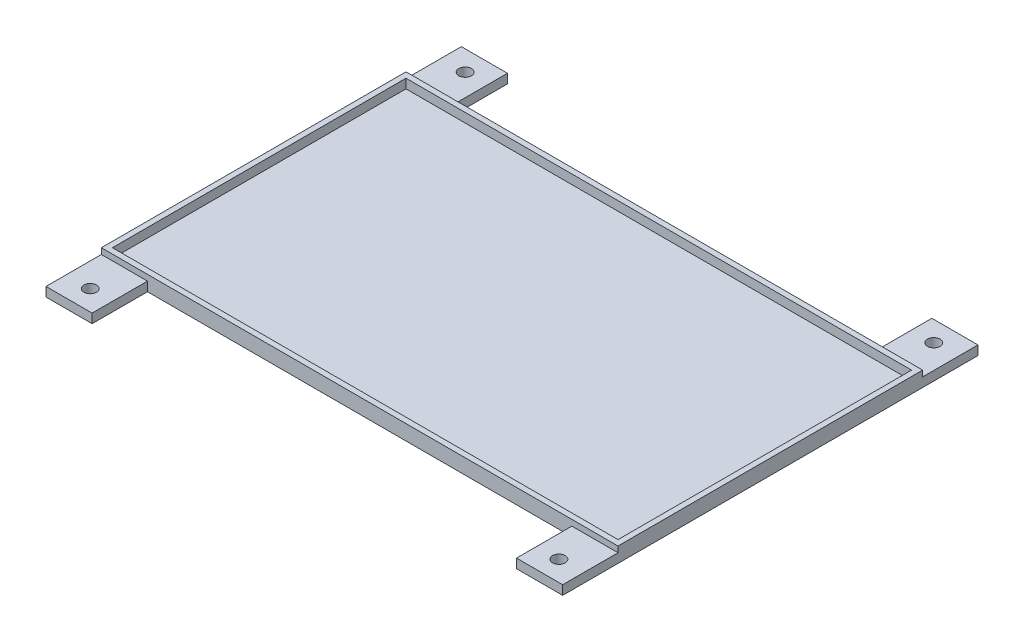
from build123d import *

# Parameters (mm, degrees)
SKETCH1_W           = 280
SKETCH1_H           = 165.1
BOSS_EXTRUDE1_DEPTH = 3.175
SKETCH2_W           = 280
SKETCH2_H           = 165.1
SKETCH2_W_2         = 274
SKETCH2_H_2         = 159.1
BOSS_EXTRUDE2_DEPTH = 5
SKETCH3_W           = 25
SKETCH3_H           = 30
SKETCH3_R           = 3.429
BOSS_EXTRUDE3_DEPTH = 5


with BuildPart() as part:
    # Sketch1 → Boss-Extrude1 (new body)
    with BuildSketch(Plane(origin=(0, 0, 0), x_dir=(1, 0, 0), z_dir=(0, 1, 0))):
        Rectangle(SKETCH1_W, SKETCH1_H)
    extrude(amount=BOSS_EXTRUDE1_DEPTH)

    # Sketch2 → Boss-Extrude2 (add)
    with BuildSketch(Plane(origin=(0, 3.175, 0), x_dir=(1, 0, 0), z_dir=(0, 1, 0))):
        Rectangle(SKETCH2_W, SKETCH2_H)
        Rectangle(SKETCH2_W_2, SKETCH2_H_2, mode=Mode.SUBTRACT)
    extrude(amount=BOSS_EXTRUDE2_DEPTH)

    # Sketch3 → Boss-Extrude3 (add)
    # profile 1 of 4: a face of its own
    with BuildSketch(Plane(origin=(0, 0, 0), x_dir=(1, 0, 0), z_dir=(0, 1, 0))):
        with Locations((-127.5, 97.55)):
            Rectangle(SKETCH3_W, SKETCH3_H)
        with Locations((-127, 101.6)):
            Circle(SKETCH3_R, mode=Mode.SUBTRACT)
    # profile 2 of 4: a face of its own
    with BuildSketch(Plane(origin=(0, 0, 0), x_dir=(1, 0, 0), z_dir=(0, 1, 0))):
        with Locations((127.5, 97.55)):
            Rectangle(SKETCH3_W, SKETCH3_H)
        with Locations((127, 101.6)):
            Circle(SKETCH3_R, mode=Mode.SUBTRACT)
    # profile 3 of 4: a face of its own
    with BuildSketch(Plane(origin=(0, 0, 0), x_dir=(1, 0, 0), z_dir=(0, 1, 0))):
        with Locations((-127.5, -97.55)):
            Rectangle(SKETCH3_W, SKETCH3_H)
        with Locations((-127, -101.6)):
            Circle(SKETCH3_R, mode=Mode.SUBTRACT)
    # profile 4 of 4: a face of its own
    with BuildSketch(Plane(origin=(0, 0, 0), x_dir=(1, 0, 0), z_dir=(0, 1, 0))):
        with Locations((127.5, -97.55)):
            Rectangle(SKETCH3_W, SKETCH3_H)
        with Locations((127, -101.6)):
            Circle(SKETCH3_R, mode=Mode.SUBTRACT)
    extrude(amount=BOSS_EXTRUDE3_DEPTH)


solid = part.part
